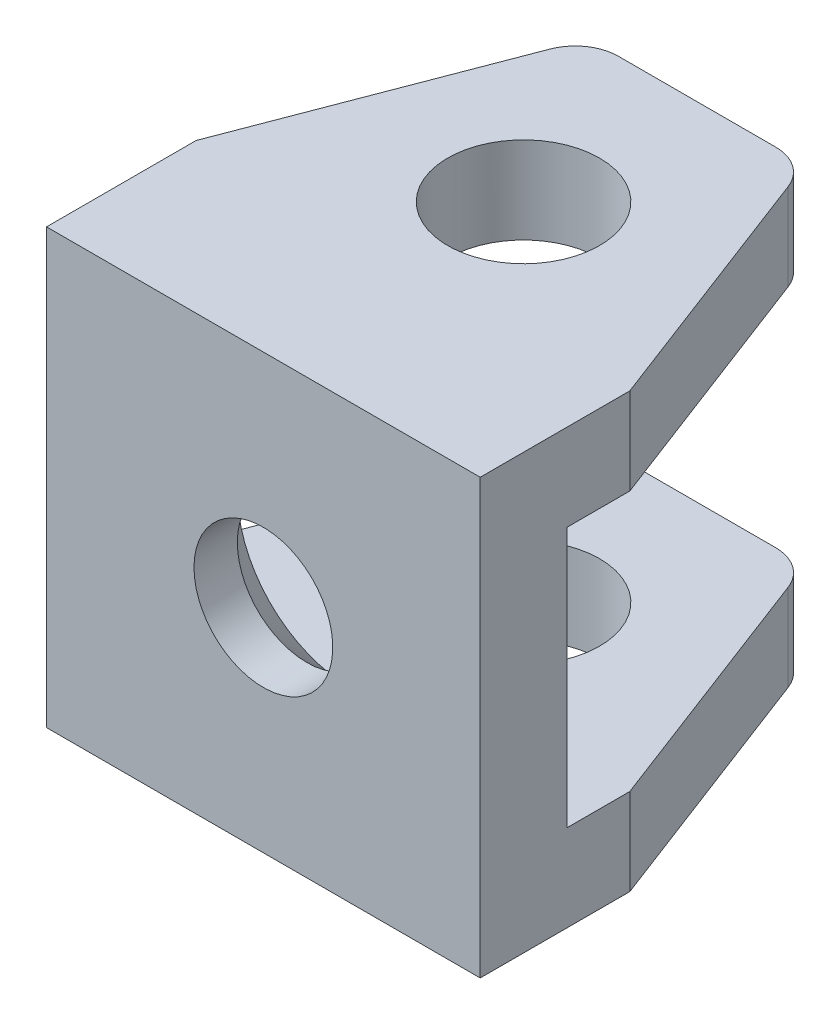
from build123d import *

# Parameters (mm, degrees)
EXTRUDE_1_DEPTH     = 10
SKETCH_2_W          = 8
SKETCH_2_H          = 6
CUT_EXTRUDE_1_DEPTH = 10
SKETCH_3_R          = 1.75
CUT_EXTRUDE_2_DEPTH = 10
FILLET_1_R          = 1
SKETCH_4_R          = 1.6
CUT_EXTRUDE_3_DEPTH = 10
CHAMFER_1_SIZE      = 1


with BuildPart() as part:
    # 草图1 → 凸台-拉伸1 (new body)
    with BuildSketch(Plane(origin=(0, 0, 0), x_dir=(1, 0, 0), z_dir=(0, 1, 0))):
        Polygon((-2.5, 5), (-5, -1.550851348), (-5, -5), (5, -5), (5, -1.550851348), (2.5, 5), align=None)
    extrude(amount=EXTRUDE_1_DEPTH)

    # 草图2 → 切除-拉伸1 (cut)
    with BuildSketch(Plane(origin=(5, 0, 0), x_dir=(0, 0, -1), z_dir=(1, 0, 0))):
        with Locations((1, 5)):
            Rectangle(SKETCH_2_W, SKETCH_2_H)
    extrude(amount=-CUT_EXTRUDE_1_DEPTH, mode=Mode.SUBTRACT)

    # 草图3 → 切除-拉伸2 (cut)
    with BuildSketch(Plane.XZ):
        with Locations((0, -1)):
            Circle(SKETCH_3_R)
    extrude(amount=-CUT_EXTRUDE_2_DEPTH, mode=Mode.SUBTRACT)

    # 圆角1
    fillet_1_edges = [part.edges().sort_by_distance(p)[0] for p in [
        (-2.5, 9, -5),
        (2.5, 9, -5),
        (-2.5, 1, -5),
        (2.5, 1, -5),
    ]]
    fillet(fillet_1_edges, radius=FILLET_1_R)

    # 草图4 → 切除-拉伸3 (cut)
    with BuildSketch(Plane(origin=(0, 0, 3), x_dir=(-1, 0, 0), z_dir=(0, 0, -1))):
        with Locations((0, 4.900814168)):
            Circle(SKETCH_4_R)
    extrude(amount=-CUT_EXTRUDE_3_DEPTH, mode=Mode.SUBTRACT)

    # 倒角1
    chamfer_1_edges = [part.edges().sort_by_distance(p)[0] for p in [
        (1.6, 4.900814168, 3),
    ]]
    chamfer(chamfer_1_edges, length=CHAMFER_1_SIZE)


solid = part.part
